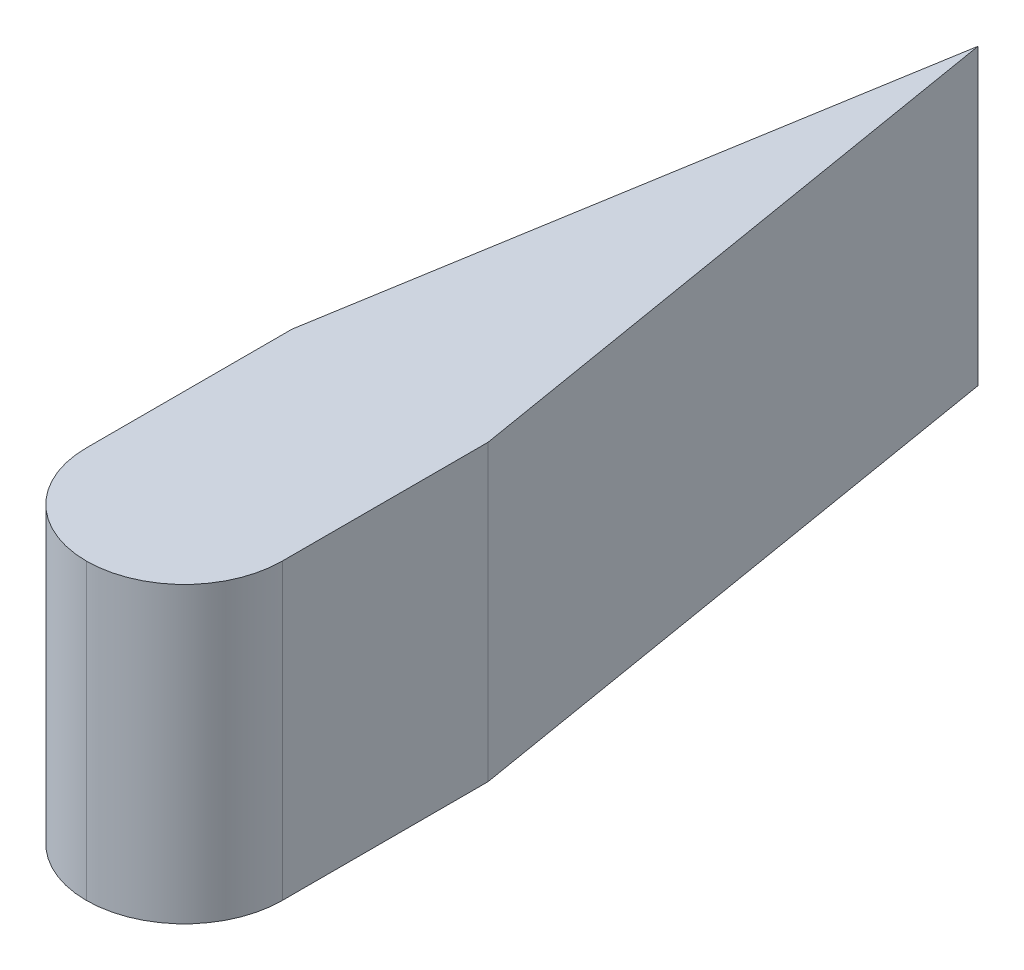
from build123d import *

# Parameters (mm, degrees)
BOSS_EXTRUDE1_DEPTH = 19.05
FILLET1_R           = 6.35
SKETCH3_R           = 3.353621891
CUT_EXTRUDE1_DEPTH  = 12.7


with BuildPart() as part:
    # Sketch1 → Boss-Extrude1 (new body)
    with BuildSketch(Plane(origin=(0, 0, 0), x_dir=(1, 0, 0), z_dir=(0, 1, 0))):
        Polygon((0, 38.1), (-6.35, 0), (-6.35, -19.685), (6.35, -19.685), (6.35, 0), align=None)
    extrude(amount=BOSS_EXTRUDE1_DEPTH)

    # Fillet1
    fillet1_edges = [part.edges().sort_by_distance(p)[0] for p in [
        (-6.35, 9.525, 19.685),
        (6.35, 9.525, 19.685),
    ]]
    fillet(fillet1_edges, radius=FILLET1_R - 0.0001)  # a hair under: the kernel refuses the full size

    # Sketch3 → Cut-Extrude1 (cut)
    with BuildSketch(Plane.XZ):
        with Locations(Location((0, 13.621650325, 0), (0, 0, 270))):
            Circle(SKETCH3_R)
    extrude(amount=-CUT_EXTRUDE1_DEPTH, mode=Mode.SUBTRACT)


solid = part.part
